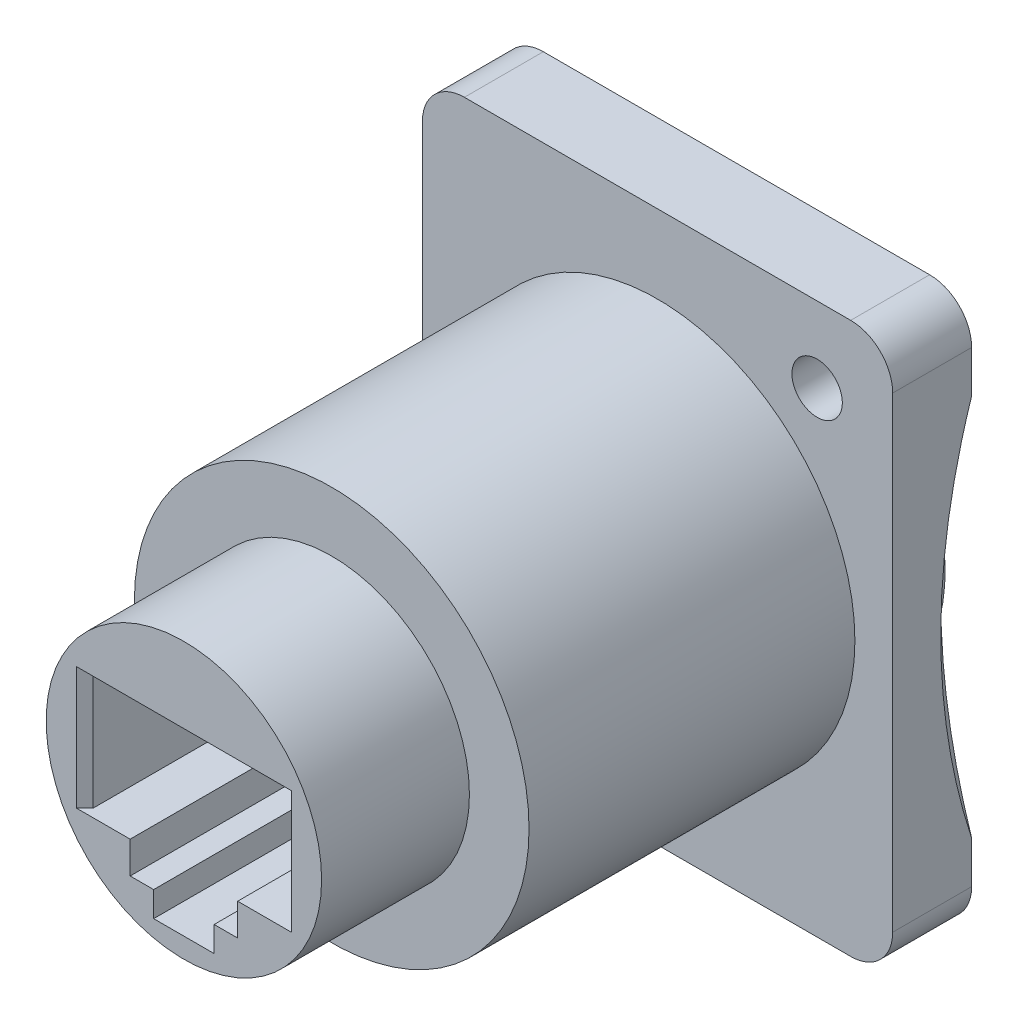
from build123d import *

# Parameters (mm, degrees)
ESQUISSE1_R                   = 11.75
BOSS_EXTRU_1_DEPTH            = 19.4
ESQUISSE2_R                   = 8.2
BOSS_EXTRU_2_DEPTH            = 8.8
ENL_V_START                   = -5.9
ENL_V_MAT_EXTRU_1_OUTLINE_W   = 6.8
ENL_V_MAT_EXTRU_1_OUTLINE_H   = 12.3
ENL_V_MAT_EXTRU_1_DEPTH       = 11.8
ENL_V_START_2                 = -1.8
ENL_V_MAT_EXTRU_1_2_OUTLINE_W = 3.4
ENL_V_MAT_EXTRU_1_2_OUTLINE_H = 12.3
ENL_V_MAT_EXTRU_1_2_DEPTH     = 3.6
ENL_V_START_3                 = -3.2
ENL_V_MAT_EXTRU_1_3_OUTLINE_W = 1.9
ENL_V_MAT_EXTRU_1_3_OUTLINE_H = 12.3
ENL_V_MAT_EXTRU_1_3_DEPTH     = 6.4
BOSS_EXTRU_3_START            = -4.7
BOSS_EXTRU_3_OUTLINE_W        = 28
BOSS_EXTRU_3_OUTLINE_H        = 32.8
BOSS_EXTRU_3_OUTLINE_R        = 1.5
BOSS_EXTRU_3_DEPTH            = 4.7
ESQUISSE5_R                   = 11.25
BOSS_EXTRU_4_DEPTH            = 1.6
BOSS_EXTRU_4_TAPER            = 15
ESQUISSE6_R                   = 9.5
ESQUISSE6_R_2                 = 8
ENL_V_MAT_EXTRU_2_DEPTH       = 13.5
ENL_V_MAT_EXTRU_3_DEPTH       = 12.5
CHANFREIN1_SIZE               = 1.5
CONG_1_R                      = 2.5
ENL_V_MAT_EXTRU_4_DEPTH       = 2.5
ENL_V_MAT_EXTRU_4_DEPTH_BACK  = 35.225502188
ENL_V_MAT_EXTRU_5_DEPTH       = 2.5
ENL_V_MAT_EXTRU_5_DEPTH_BACK  = 35.225502188
ESQUISSE10_W                  = 8
ESQUISSE10_H                  = 5.5
ENL_V_MAT_EXTRU_6_DEPTH       = 5
ESQUISSE11_W                  = 7.8
ESQUISSE11_H                  = 4
BOSS_EXTRU_5_DEPTH            = 7.4
ESQUISSE12_W                  = 7.8
ESQUISSE12_H                  = 6
BOSS_EXTRU_6_DEPTH            = 2.5
CHANFREIN2_SIZE               = 0.5


# Read off the part's stored shape, not the designer's step: Enlèv. mat.-Extru.1, Boss.-Extru.3
with BuildPart() as part:
    # Esquisse1 → Boss.-Extru.1 (new body)
    with BuildSketch(Plane.XY):
        Circle(ESQUISSE1_R)
    extrude(amount=BOSS_EXTRU_1_DEPTH)

    # Esquisse2 → Boss.-Extru.2 (add)
    with BuildSketch(Plane.XY.offset(19.4)):
        Circle(ESQUISSE2_R)
    extrude(amount=BOSS_EXTRU_2_DEPTH)

    # Enlèv. mat.-Extru.1 outline → Enlèv. mat.-Extru.1 (cut)
    with BuildSketch(Plane.YZ.offset(ENL_V_START)):
        with Locations((-0.2, 22.05)):
            Rectangle(ENL_V_MAT_EXTRU_1_OUTLINE_W, ENL_V_MAT_EXTRU_1_OUTLINE_H)
    extrude(amount=ENL_V_MAT_EXTRU_1_DEPTH, mode=Mode.SUBTRACT)

    # Enl_v. mat.-Extru.1 2 outline → Enl_v. mat.-Extru.1 2 (cut)
    with BuildSketch(Plane.YZ.offset(ENL_V_START_2)):
        with Locations((-5.3, 22.05)):
            Rectangle(ENL_V_MAT_EXTRU_1_2_OUTLINE_W, ENL_V_MAT_EXTRU_1_2_OUTLINE_H)
    extrude(amount=ENL_V_MAT_EXTRU_1_2_DEPTH, mode=Mode.SUBTRACT)

    # Enl_v. mat.-Extru.1 3 outline → Enl_v. mat.-Extru.1 3 (cut)
    with BuildSketch(Plane.YZ.offset(ENL_V_START_3)):
        with Locations((-4.55, 22.05)):
            Rectangle(ENL_V_MAT_EXTRU_1_3_OUTLINE_W, ENL_V_MAT_EXTRU_1_3_OUTLINE_H)
    extrude(amount=ENL_V_MAT_EXTRU_1_3_DEPTH, mode=Mode.SUBTRACT)

    # Boss.-Extru.3 outline → Boss.-Extru.3 (add)
    with BuildSketch(Plane.XY.offset(BOSS_EXTRU_3_START)):
        Rectangle(BOSS_EXTRU_3_OUTLINE_W, BOSS_EXTRU_3_OUTLINE_H)
        with Locations((-9.5, -11.9)):
            Circle(BOSS_EXTRU_3_OUTLINE_R, mode=Mode.SUBTRACT)
        with Locations((9.5, 11.9)):
            Circle(BOSS_EXTRU_3_OUTLINE_R, mode=Mode.SUBTRACT)
    extrude(amount=BOSS_EXTRU_3_DEPTH)

    # Esquisse5 → Boss.-Extru.4 (add)
    with BuildSketch(Plane(origin=(0, 0, -4.7), x_dir=(-1, 0, 0), z_dir=(0, 0, -1))):
        Circle(ESQUISSE5_R)
    extrude(amount=BOSS_EXTRU_4_DEPTH, taper=BOSS_EXTRU_4_TAPER)

    # Esquisse6 → Enlèv. mat.-Extru.2 (cut)
    with BuildSketch(Plane(origin=(0, 0, -6.3), x_dir=(-1, 0, 0), z_dir=(0, 0, -1))):
        Circle(ESQUISSE6_R)
        Circle(ESQUISSE6_R_2, mode=Mode.SUBTRACT)
    extrude(amount=-ENL_V_MAT_EXTRU_2_DEPTH, mode=Mode.SUBTRACT)

    # Esquisse7 → Enlèv. mat.-Extru.3 (cut)
    with BuildSketch(Plane(origin=(0, 0, -6.3), x_dir=(-1, 0, 0), z_dir=(0, 0, -1))):
        Polygon((-3.2, 3.4), (-3.2, 5.3), (-1.8, 5.3), (-1.8, 6.8), (1.8, 6.8), (1.8, 5.3), (3.2, 5.3), (3.2, 3.4), (5.9, 3.4), (5.9, -3.4), (-5.9, -3.4), (-5.9, 3.4), align=None)
    extrude(amount=-ENL_V_MAT_EXTRU_3_DEPTH, mode=Mode.SUBTRACT)

    # Chanfrein1
    chanfrein1_edges = [part.edges().sort_by_distance(p)[0] for p in [
        (8, 11.9, -4.7),
        (-11, -11.9, -4.7),
    ]]
    chamfer(chanfrein1_edges, length=CHANFREIN1_SIZE)

    # Congé1
    cong_1_edges = [part.edges().sort_by_distance(p)[0] for p in [
        (14, 16.4, -2.35),
        (14, -16.4, -2.35),
        (-14, -16.4, -2.35),
        (-14, 16.4, -2.35),
    ]]
    fillet(cong_1_edges, radius=CONG_1_R)

    # Esquisse8 → Enlèv. mat.-Extru.4 (cut, two sides: drawn at the far end of the back side and taken through both)
    with BuildSketch(Plane(origin=(-4.65, 0, 4.65), x_dir=(0, 1, 0), z_dir=(0.7071067811865464, 0, -0.7071067811865488)).offset(-ENL_V_MAT_EXTRU_4_DEPTH_BACK)):
        with BuildLine():
            Line((-11.4, -13.222896808), (11.4, -13.222896808))
            ThreePointArc((11.4, -13.222896808), (0, -11.922896808), (-11.4, -13.222896808))
        make_face()
    extrude(amount=ENL_V_MAT_EXTRU_4_DEPTH + ENL_V_MAT_EXTRU_4_DEPTH_BACK, mode=Mode.SUBTRACT)

    # Esquisse9 → Enlèv. mat.-Extru.5 (cut, two sides: drawn at the far end of the back side and taken through both)
    with BuildSketch(Plane(origin=(4.65, 0, 4.65), x_dir=(0, -1, 0), z_dir=(-0.7071067811865464, 0, -0.7071067811865488)).offset(-ENL_V_MAT_EXTRU_5_DEPTH_BACK)):
        with BuildLine():
            Line((-11.4, -13.222896808), (11.4, -13.222896808))
            ThreePointArc((11.4, -13.222896808), (0, -11.922896808), (-11.4, -13.222896808))
        make_face()
    extrude(amount=ENL_V_MAT_EXTRU_5_DEPTH + ENL_V_MAT_EXTRU_5_DEPTH_BACK, mode=Mode.SUBTRACT)

    # Esquisse10 → Enlèv. mat.-Extru.6 (cut)
    with BuildSketch(Plane(origin=(0, 0, -6.3), x_dir=(-1, 0, 0), z_dir=(0, 0, -1))):
        with Locations((0, -11.25)):
            Rectangle(ESQUISSE10_W, ESQUISSE10_H)
    extrude(amount=-ENL_V_MAT_EXTRU_6_DEPTH, mode=Mode.SUBTRACT)

    # Esquisse11 → Boss.-Extru.5 (add)
    with BuildSketch(Plane(origin=(0, 0, -1.3), x_dir=(-1, 0, 0), z_dir=(0, 0, -1))):
        with Locations((0, -11.9)):
            Rectangle(ESQUISSE11_W, ESQUISSE11_H)
    extrude(amount=BOSS_EXTRU_5_DEPTH)

    # Esquisse12 → Boss.-Extru.6 (add)
    with BuildSketch(Plane(origin=(0, 0, -8.7), x_dir=(-1, 0, 0), z_dir=(0, 0, -1))):
        with Locations((0, -12.9)):
            Rectangle(ESQUISSE12_W, ESQUISSE12_H)
    extrude(amount=BOSS_EXTRU_6_DEPTH)

    # Chanfrein2
    chanfrein2_edges = [part.edges().sort_by_distance(p)[0] for p in [
        (5.9, -0.2, 28.2),
        (0, 3.2, 28.2),
        (-5.9, -0.2, 28.2),
        (5.9, 0, -6.3),
        (0, -3.4, -6.3),
        (-5.9, 0, -6.3),
    ]]
    chamfer(chanfrein2_edges, length=CHANFREIN2_SIZE)


solid = part.part
